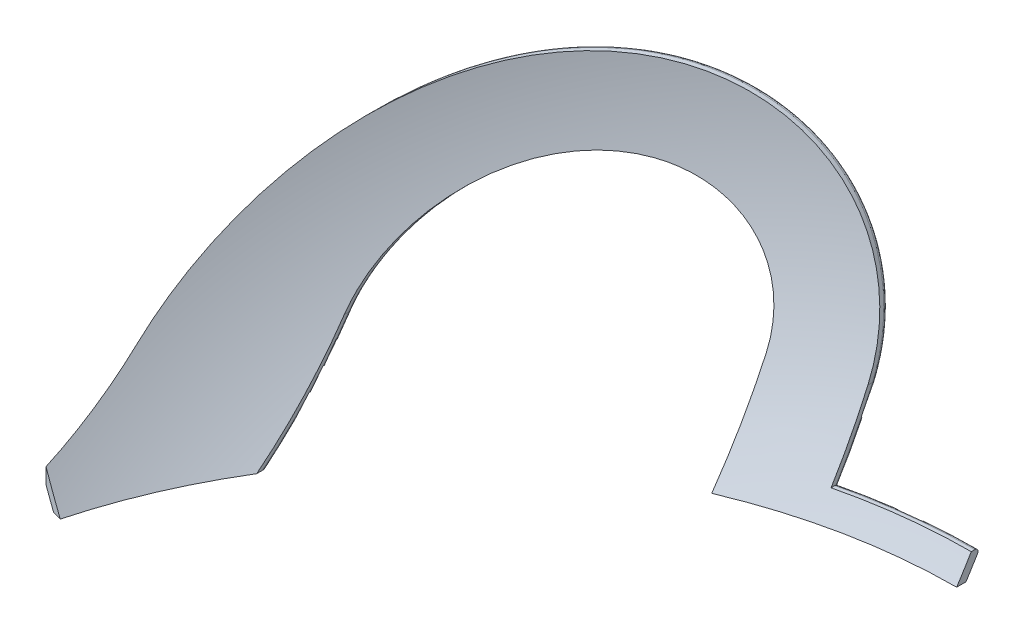
from build123d import *

# Parameters (mm, degrees)
REVOLVE1_ANGLE     = 75
CUT_EXTRUDE1_DEPTH = 390.903831419
FILLET1_R          = 1.27


with BuildPart() as part:
    # Sketch1 → Revolve1 (revolve)
    with BuildSketch(Plane(origin=(0, 0, 0), x_dir=(0, 0, -1), z_dir=(1, 0, 0))):
        with BuildLine():
            Line((230.505, -11.795080514), (234.28613444, -11.795080514))
            ThreePointArc((234.28613444, -11.795080514), (263.799017359, 52.075880233), (274.897350101, 121.554919486))
            Line((274.897350101, 121.554919486), (271.721629313, 121.554919486))
            ThreePointArc((271.721629313, 121.554919486), (260.45260116, 51.993275992), (230.505, -11.795080514))
        make_face()
    revolve(axis=Axis((0, 127, -17.78), (0, -1, 0)), revolution_arc=REVOLVE1_ANGLE)

    # Sketch2 → Cut-Extrude1 (cut, through all)
    with BuildSketch(Plane.XY):
        with BuildLine():
            add(Edge.make_bspline(
                [(213.36, -4.712274758), (246.966953148, 53.636042627), (248.35628885, 121.554919486)],
                knots=[1.033449564, 1.033449564, 1.033449564, 1.549622078, 1.549622078, 1.549622078], degree=2, weights=[0.995803699, 0.964806112, 1]))
            Line((248.35628885, 121.554919486), (0, 121.554919486))
            Line((0, 121.554919486), (0, -2.270080514))
            Line((0, -2.270080514), (50.8, -2.270080514))
            Line((50.8, -2.270080514), (50.8, 26.304919486))
            ThreePointArc((50.8, 26.304919486), (132.08, 107.584919486), (213.36, 26.304919486))
            Line((213.36, 26.304919486), (213.36, -4.712274758))
        make_face()
        with BuildLine():
            Line((82.55, -11.795080514), (181.61, -11.795080514))
            Line((181.61, -11.795080514), (181.61, 26.304919486))
            ThreePointArc((181.61, 26.304919486), (132.08, 75.834919486), (82.55, 26.304919486))
            Line((82.55, 26.304919486), (82.55, -11.795080514))
        make_face()
    extrude(amount=-CUT_EXTRUDE1_DEPTH, mode=Mode.SUBTRACT)

    # Fillet1
    fillet1_edges = [part.edges().sort_by_distance(p)[0] for p in [
        (25.569673431, -2.270080514, -238.629312223),
        (213.36, 8.620216721, -99.037110063),
        (148.74121332, 105.858941186, -226.509700128),
        (50.8, 11.783312592, -242.019727898),
        (82.55, 6.767706682, -229.602269293),
        (139.725317673, 75.241306953, -227.391197031),
        (181.61, 6.06492839, -153.910441047),
    ]]
    fillet(fillet1_edges, radius=FILLET1_R)


with BuildPart() as body_2:
    # Mirror1: mirrored copy
    add(part.part.mirror(Plane(origin=(0, 127, -17.78), x_dir=(0, 0, 1), z_dir=(1, 0, 0))))


solid = body_2.part
